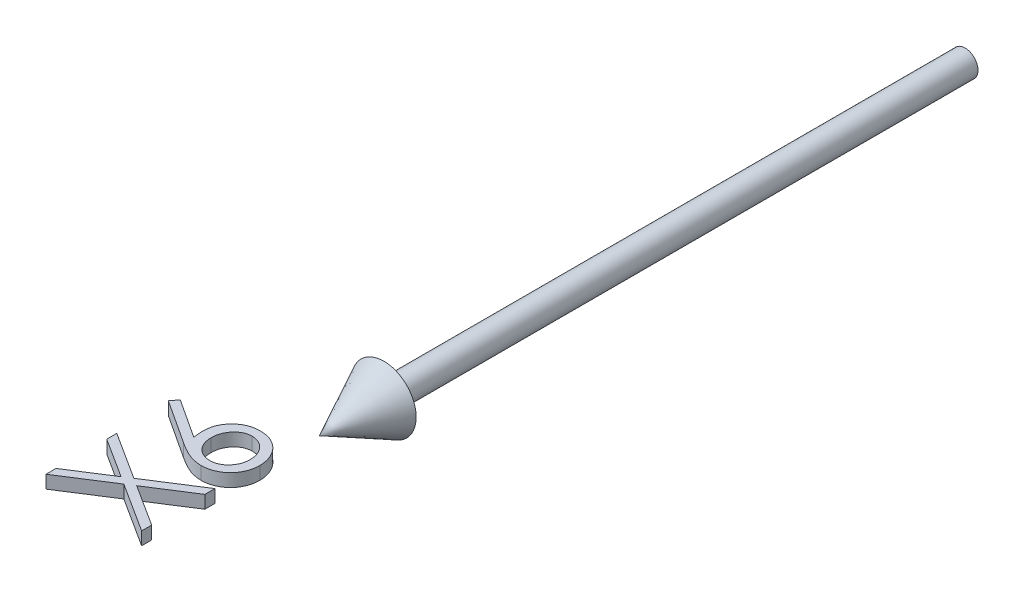
from build123d import *

# Parameters (mm, degrees)
BOSS_EXTRUDE1_DEPTH        = 1
BOSS_EXTRUDE1_DEPTH_BACK   = 1
BOSS_EXTRUDE1_2_DEPTH      = 1
BOSS_EXTRUDE1_2_DEPTH_BACK = 1


with BuildPart() as part:
    # Sketch2 → Revolve1 (revolve)
    with BuildSketch(Plane(origin=(0, 0, 0), x_dir=(1, 0, 0), z_dir=(0, 1, 0))):
        Polygon((0, -100), (5, -90), (2, -90), (2, 0), (0, 0), align=None)
    revolve(axis=Axis((0, 0, -41.949952025), (0, 0, 1)))


with BuildPart() as body_2:
    # Sketch3 → Boss-Extrude1 (new, two sides: drawn at the far end of the back side and taken through both)
    with BuildSketch(Plane(origin=(0, 0, 0), x_dir=(1, 0, 0), z_dir=(0, 1, 0)).offset(-BOSS_EXTRUDE1_DEPTH_BACK)):
        with BuildLine():
            Line((-15.384615385, -107.991265497), (-14.5703125, -106.954606843))
            Line((-14.5703125, -106.954606843), (-8.509615385, -110.917948189))
            add(Edge.make_bspline(
                [(-8.509615385, -110.917948189), (-8.551674787, -110.654075574), (-8.633716408, -110.139362202), (-8.64725046, -109.618365494), (-8.653846154, -109.364462612)],
                knots=[0, 0, 0, 0, 1.025318673, 2, 2, 2, 2], degree=3))
            add(Edge.make_bspline(
                [(-8.653846154, -109.364462612), (-8.649748532, -109.212009056), (-8.641682487, -108.911908768), (-8.579608839, -108.471308192), (-8.481786938, -108.047927021), (-8.339191529, -107.643520172), (-8.157038681, -107.25663574), (-7.93872886, -106.88505489), (-7.67299167, -106.535757315), (-7.376136314, -106.204264763), (-7.047369878, -105.903244963), (-6.698432357, -105.636944418), (-6.329351346, -105.412031362), (-5.940209844, -105.232841882), (-5.534053996, -105.089637754), (-5.109299766, -104.987693846), (-4.665230263, -104.926750243), (-4.363171943, -104.918522076), (-4.209735577, -104.91434242)],
                knots=[0, 0, 0, 0, 1.043709831, 2.054511743, 3.041122595, 4.01515914, 4.98481438, 5.965901842, 6.960491961, 7.985277438, 9.0096037, 10.00832444, 10.987059228, 11.962929573, 12.936966118, 13.931840027, 14.949438142, 16, 16, 16, 16], degree=3))
            add(Edge.make_bspline(
                [(-4.209735577, -104.91434242), (-3.999814704, -104.920426619), (-3.586740106, -104.932398881), (-2.985237872, -105.05219832), (-2.412540694, -105.236965371), (-1.878558323, -105.505287369), (-1.379592346, -105.83225651), (-0.938932231, -106.235889656), (-0.545933647, -106.696160767), (-0.217440639, -107.216874434), (0.050867747, -107.777186236), (0.243573381, -108.365841683), (0.362217491, -108.977099823), (0.377091411, -109.391976858), (0.384615385, -109.60184242)],
                knots=[0, 0, 0, 0, 1.031403119, 2.029557249, 3.004870281, 3.983165322, 4.960181699, 5.929903783, 6.912123683, 7.928973898, 8.949315281, 9.960468141, 10.968302741, 12, 12, 12, 12], degree=3))
            add(Edge.make_bspline(
                [(0.384615385, -109.60184242), (0.378084543, -109.803693918), (0.36514809, -110.203526395), (0.249307568, -110.791542689), (0.062885284, -111.357555216), (-0.199330062, -111.894298419), (-0.524946662, -112.392335166), (-0.91421359, -112.841464176), (-1.367671637, -113.22964844), (-1.87540114, -113.555606384), (-2.420231006, -113.815231815), (-2.98931297, -114.008109552), (-3.580257904, -114.121368108), (-3.980898774, -114.137158431), (-4.182692308, -114.145111651)],
                knots=[0, 0, 0, 0, 1.012172929, 2.004937354, 2.995255351, 3.995689452, 4.993936421, 5.973737378, 6.968231049, 7.979117505, 8.993136101, 9.989812463, 10.987515067, 12, 12, 12, 12], degree=3))
            add(Edge.make_bspline(
                [(-4.182692308, -114.145111651), (-4.337169093, -114.140048315), (-4.652581173, -114.129709951), (-5.13028415, -114.057523992), (-5.6190745, -113.941532015), (-6.03373533, -113.811630959), (-6.373427567, -113.674378344), (-6.647299669, -113.560153175), (-6.92913284, -113.417978906), (-7.22859128, -113.266378701), (-7.53795742, -113.091706406), (-7.862401718, -112.901782194), (-8.196764265, -112.691355119), (-8.423667959, -112.543840135), (-8.539663462, -112.468428959)],
                knots=[0, 0, 0, 0, 1.173818275, 2.396712641, 3.66331629, 4.989737886, 5.693666774, 6.447286557, 7.243889047, 8.091586357, 8.998013824, 9.943181721, 10.948533338, 12, 12, 12, 12], degree=3))
            Line((-8.539663462, -112.468428959), (-15.384615385, -107.991265497))
        make_face()
        with BuildLine():
            add(Edge.make_bspline(
                [(-7.115384615, -109.646914535), (-7.112082335, -109.761192431), (-7.105632021, -109.984410359), (-7.067359224, -110.311714994), (-6.997698373, -110.622492515), (-6.901107529, -110.916833127), (-6.782022326, -111.196552611), (-6.629225554, -111.4561077), (-6.451252186, -111.700839449), (-6.248424191, -111.926837687), (-6.026504548, -112.131791162), (-5.788770456, -112.308278582), (-5.54099726, -112.460518253), (-5.281102705, -112.584297262), (-5.009189275, -112.680683359), (-4.726506739, -112.750404418), (-4.431159723, -112.789206214), (-4.230877567, -112.795661491), (-4.128605769, -112.798957805)],
                knots=[0, 0, 0, 0, 1.129656352, 2.206547016, 3.251334079, 4.271920891, 5.265058649, 6.249872215, 7.241923875, 8.251504132, 9.246416584, 10.222533834, 11.173322129, 12.116503788, 13.062124155, 14.020151864, 14.989013135, 16, 16, 16, 16], degree=3))
            add(Edge.make_bspline(
                [(-4.128605769, -112.798957805), (-4.027266421, -112.796178338), (-3.827564804, -112.790701058), (-3.534423223, -112.744067524), (-3.252971083, -112.669528686), (-2.984266134, -112.561852309), (-2.723149948, -112.431004064), (-2.47777361, -112.263050268), (-2.240188862, -112.070288108), (-2.021434681, -111.845220677), (-1.818352216, -111.601833689), (-1.640109433, -111.342348645), (-1.489386675, -111.070672522), (-1.364496219, -110.78758777), (-1.272559029, -110.489595101), (-1.202176111, -110.181533165), (-1.16369681, -109.859213497), (-1.157172802, -109.640997354), (-1.153846154, -109.529727035)],
                knots=[0, 0, 0, 0, 0.989367052, 1.949669134, 2.891858276, 3.827522767, 4.772653562, 5.738670152, 6.725809442, 7.756636004, 8.798867547, 9.819240912, 10.826537776, 11.829883227, 12.835515726, 13.868058748, 14.912904531, 16, 16, 16, 16], degree=3))
            add(Edge.make_bspline(
                [(-1.153846154, -109.529727035), (-1.157173061, -109.4184569), (-1.163697577, -109.200241114), (-1.202173196, -108.877918852), (-1.272569713, -108.569866498), (-1.364457508, -108.271839023), (-1.489531157, -107.988883358), (-1.639166208, -107.71744471), (-1.819445103, -107.460413828), (-2.021085993, -107.216868449), (-2.241438867, -106.992736363), (-2.475632853, -106.795440641), (-2.725113333, -106.632734086), (-2.983239431, -106.4966978), (-3.253131579, -106.390213671), (-3.534379419, -106.315307866), (-3.827576232, -106.26877354), (-4.027270268, -106.263282643), (-4.128605769, -106.260496266)],
                knots=[0, 0, 0, 0, 1.087281468, 2.132306021, 3.165025708, 4.170830268, 5.174347389, 6.181816599, 7.194310624, 8.23672049, 9.267723423, 10.261267456, 11.222032883, 12.171822355, 13.107646935, 14.049997283, 15.01046367, 16, 16, 16, 16], degree=3))
            add(Edge.make_bspline(
                [(-4.128605769, -106.260496266), (-4.231010988, -106.262854664), (-4.431999129, -106.267483433), (-4.726374626, -106.319837503), (-5.010625546, -106.392447662), (-5.282965192, -106.502089275), (-5.542319679, -106.644531408), (-5.78999599, -106.818032504), (-6.027905239, -107.01874046), (-6.248858458, -107.25059898), (-6.451032293, -107.502940399), (-6.628980787, -107.771458852), (-6.78087835, -108.051258062), (-6.900737553, -108.34627941), (-6.997297489, -108.652553409), (-7.067110856, -108.972194924), (-7.105532253, -109.305431292), (-7.112058665, -109.531636954), (-7.115384615, -109.646914535)],
                knots=[0, 0, 0, 0, 0.978259475, 1.920005202, 2.851759169, 3.7803069, 4.719124913, 5.675758531, 6.668034766, 7.691045932, 8.733780038, 9.756656648, 10.768121246, 11.773215211, 12.79725739, 13.836288844, 14.897342417, 16, 16, 16, 16], degree=3))
        make_face(mode=Mode.SUBTRACT)
    extrude(amount=BOSS_EXTRUDE1_DEPTH + BOSS_EXTRUDE1_DEPTH_BACK)


with BuildPart() as body_3:
    # Sketch3 → Boss-Extrude1 2 (new, two sides: drawn at the far end of the back side and taken through both)
    with BuildSketch(Plane(origin=(0, 0, 0), x_dir=(1, 0, 0), z_dir=(0, 1, 0)).offset(-BOSS_EXTRUDE1_2_DEPTH_BACK)):
        Polygon((-15, -127.318188574), (-15, -125.764702997), (-8.864182692, -121.837419343), (-15, -117.910135689), (-15, -116.356650112), (-7.650240385, -121.059174151), (0, -116.16434242), (0, -117.717827997), (-6.436298077, -121.837419343), (0, -125.957010689), (0, -127.510496266), (-7.650240385, -122.612659728), align=None)
    extrude(amount=BOSS_EXTRUDE1_2_DEPTH + BOSS_EXTRUDE1_2_DEPTH_BACK)


solid = Compound([part.part, body_2.part, body_3.part])
